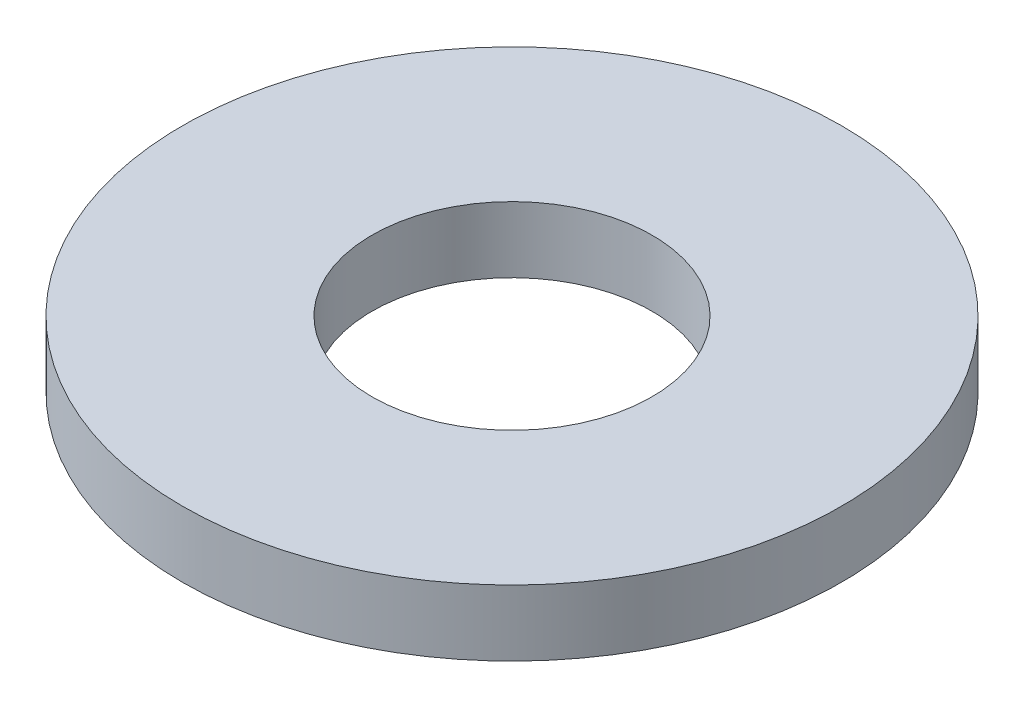
from build123d import *

# Parameters (mm, degrees)
SKETCH1_R           = 10
SKETCH1_R_2         = 4.25
BOSS_EXTRUDE1_DEPTH = 2


with BuildPart() as part:
    # Sketch1 → Boss-Extrude1 (new body)
    with BuildSketch(Plane(origin=(0, 0, 0), x_dir=(1, 0, 0), z_dir=(0, 1, 0))):
        Circle(SKETCH1_R)
        Circle(SKETCH1_R_2, mode=Mode.SUBTRACT)
    extrude(amount=BOSS_EXTRUDE1_DEPTH)


solid = part.part
